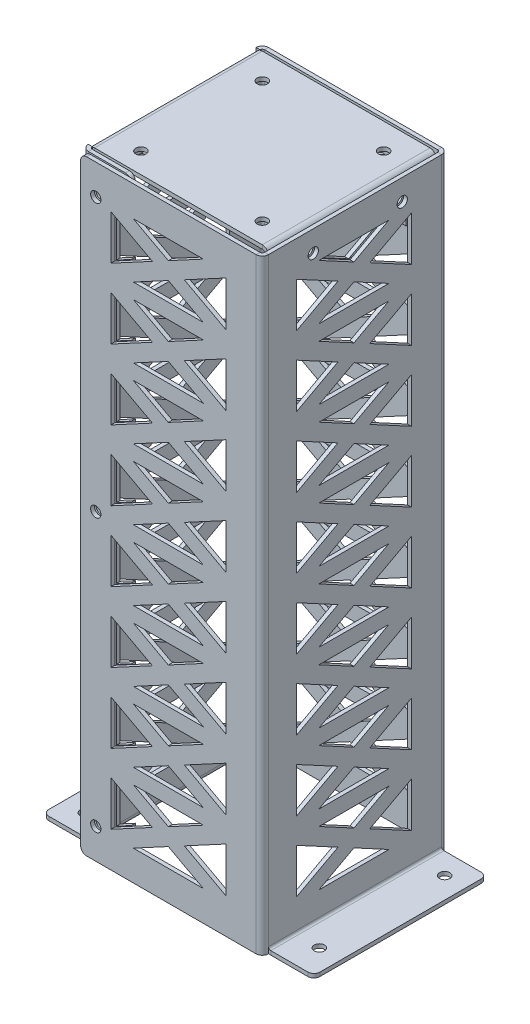
from build123d import *

# Parameters (mm, degrees)
SKETCH2_W                        = 60
SKETCH2_H                        = 200
BASE_FLANGE1_DEPTH               = 1.29
EDGE_FLANGE1_STRIP_W             = 6.684
EDGE_FLANGE1_STRIP_H             = 1.29
EDGE_FLANGE1_STRIP_CUT_DEPTH     = 200
EDGE_FLANGE1_DEPTH               = 200
EDGE_FLANGE2_STRIP_W             = 6.684
EDGE_FLANGE2_STRIP_H             = 1.29
EDGE_FLANGE2_STRIP_CUT_DEPTH     = 200
EDGE_FLANGE2_DEPTH               = 200
EDGE_FLANGE3_STRIP_W             = 6.684
EDGE_FLANGE3_STRIP_H             = 1.29
EDGE_FLANGE3_STRIP_CUT_DEPTH     = 200
EDGE_FLANGE3_DEPTH               = 200
EDGE_FLANGE4_STRIP_W             = 6.684
EDGE_FLANGE4_STRIP_H             = 1.29
EDGE_FLANGE4_STRIP_CUT_DEPTH     = 200
EDGE_FLANGE4_DEPTH               = 200
EDGE_FLANGE5_STRIP_W             = 6.684
EDGE_FLANGE5_STRIP_H             = 1.29
EDGE_FLANGE5_STRIP_CUT_DEPTH     = 57.186
EDGE_FLANGE5_DEPTH               = 57.186
EDGE_FLANGE6_STRIP_W             = 6.684
EDGE_FLANGE6_STRIP_H             = 1.29
EDGE_FLANGE6_STRIP_CUT_DEPTH     = 55.396
EDGE_FLANGE6_DEPTH               = 55.396
EDGE_FLANGE8_STRIP_W             = 6.684
EDGE_FLANGE8_STRIP_H             = 1.29
EDGE_FLANGE8_STRIP_CUT_DEPTH     = 55.396
EDGE_FLANGE8_DEPTH               = 55.396
EDGE_FLANGE9_START               = -59.238
EDGE_FLANGE9_DEPTH               = 55.396
EDGE_FLANGE9_2_DEPTH             = 55.396
SPEED_HOLE_DEPTH                 = 223.219405318
SPEED_HOLES_COUNT                = 8
SPEED_HOLES_PITCH                = 23.13
COPY_OF_SPEED_HOLES_COUNT        = 2
COPY_OF_SPEED_HOLES_ANGLE        = 90
COPY_OF_SPEED_HOLES_COPY_1_DEPTH = 223.219405318
COPY_OF_SPEED_HOLES_COPY_2_DEPTH = 223.219405318
COPY_OF_SPEED_HOLES_COPY_3_DEPTH = 223.219405318
COPY_OF_SPEED_HOLES_COPY_4_DEPTH = 223.219405318
COPY_OF_SPEED_HOLES_COPY_5_DEPTH = 223.219405318
COPY_OF_SPEED_HOLES_COPY_6_DEPTH = 223.219405318
COPY_OF_SPEED_HOLES_COPY_7_DEPTH = 223.219405318
M3_CLEARANCE_HOLE1_AT_2_COUNT    = 2
M3_CLEARANCE_HOLE1_AT_2_PITCH    = 41.396
M3_CLEARANCE_HOLE2_D             = 3.4
M3_START                         = -3.08
M3_CLEARANCE_HOLE3_OUTLINE_R     = 1.7
M3_CLEARANCE_HOLE3_DEPTH         = 3.08
M3_START_2                       = 56.92
M3_CLEARANCE_HOLE4_OUTLINE_R     = 1.7
M3_CLEARANCE_HOLE4_DEPTH         = 3.08
FILLET1_R                        = 2


# Read off the part's stored shape, not the designer's step: Edge-Flange9, M3 Clearance Hole3, M3 Clearance Hole4
# Sheet-metal steps are written as plain solids
with BuildPart() as part:
    # Sketch2 → Base-Flange1 (new body)
    with BuildSketch(Plane.XY):
        with Locations((30, 100)):
            Rectangle(SKETCH2_W, SKETCH2_H)
    extrude(amount=-BASE_FLANGE1_DEPTH)

    # Edge-Flange1 strip (across the edge) → Edge-Flange1 strip cut (cut)
    with BuildSketch(Plane(origin=(60, 200, -1.29), x_dir=(-1, 0, 0), z_dir=(0, -1, 0))):
        with Locations((-1.29, -0.645)):
            Rectangle(EDGE_FLANGE1_STRIP_W, EDGE_FLANGE1_STRIP_H)
    extrude(amount=EDGE_FLANGE1_STRIP_CUT_DEPTH, mode=Mode.SUBTRACT)

    # Edge-Flange1 section (across the edge) → Edge-Flange1 (add)
    with BuildSketch(Plane(origin=(60, 200, -1.29), x_dir=(-1, 0, 0), z_dir=(0, -1, 0))):
        with BuildLine():
            Line((0, 0.762), (0, 60))
            Line((0, 60), (1.29, 60))
            Line((1.29, 60), (1.29, 0.762))
            ThreePointArc((1.29, 0.762), (1.513184633, 0.223184633), (2.052, 0))
            Line((2.052, 0), (2.052, -1.29))
            ThreePointArc((2.052, -1.29), (0.601016885, -0.688983115), (0, 0.762))
        make_face()
    extrude(amount=EDGE_FLANGE1_DEPTH)

    # Edge-Flange2 strip (across the edge) → Edge-Flange2 strip cut (cut)
    with BuildSketch(Plane(origin=(58.71, 200, -61.29), x_dir=(0, 0, 1), z_dir=(0, -1, 0))):
        with Locations((-1.29, -0.645)):
            Rectangle(EDGE_FLANGE2_STRIP_W, EDGE_FLANGE2_STRIP_H)
    extrude(amount=EDGE_FLANGE2_STRIP_CUT_DEPTH, mode=Mode.SUBTRACT)

    # Edge-Flange2 section (across the edge) → Edge-Flange2 (add)
    with BuildSketch(Plane(origin=(58.71, 200, -61.29), x_dir=(0, 0, 1), z_dir=(0, -1, 0))):
        with BuildLine():
            Line((0, 0.762), (0, 60))
            Line((0, 60), (1.29, 60))
            Line((1.29, 60), (1.29, 0.762))
            ThreePointArc((1.29, 0.762), (1.513184633, 0.223184633), (2.052, 0))
            Line((2.052, 0), (2.052, -1.29))
            ThreePointArc((2.052, -1.29), (0.601016885, -0.688983115), (0, 0.762))
        make_face()
    extrude(amount=EDGE_FLANGE2_DEPTH)

    # Edge-Flange3 strip (across the edge) → Edge-Flange3 strip cut (cut)
    with BuildSketch(Plane(origin=(-1.29, 200, -60), x_dir=(1, 0, 0), z_dir=(0, -1, 0))):
        with Locations((-1.29, -0.645)):
            Rectangle(EDGE_FLANGE3_STRIP_W, EDGE_FLANGE3_STRIP_H)
    extrude(amount=EDGE_FLANGE3_STRIP_CUT_DEPTH, mode=Mode.SUBTRACT)

    # Edge-Flange3 section (across the edge) → Edge-Flange3 (add)
    with BuildSketch(Plane(origin=(-1.29, 200, -60), x_dir=(1, 0, 0), z_dir=(0, -1, 0))):
        with BuildLine():
            Line((0, 0.762), (0, 58.21))
            Line((0, 58.21), (1.29, 58.21))
            Line((1.29, 58.21), (1.29, 0.762))
            ThreePointArc((1.29, 0.762), (1.513184633, 0.223184633), (2.052, 0))
            Line((2.052, 0), (2.052, -1.29))
            ThreePointArc((2.052, -1.29), (0.601016885, -0.688983115), (0, 0.762))
        make_face()
    extrude(amount=EDGE_FLANGE3_DEPTH)

    # Edge-Flange4 strip (across the edge) → Edge-Flange4 strip cut (cut)
    with BuildSketch(Plane(origin=(0, 200, -1.79), x_dir=(0, 0, -1), z_dir=(0, -1, 0))):
        with Locations((-1.29, -0.645)):
            Rectangle(EDGE_FLANGE4_STRIP_W, EDGE_FLANGE4_STRIP_H)
    extrude(amount=EDGE_FLANGE4_STRIP_CUT_DEPTH, mode=Mode.SUBTRACT)

    # Edge-Flange4 section (across the edge) → Edge-Flange4 (add)
    with BuildSketch(Plane(origin=(0, 200, -1.79), x_dir=(0, 0, -1), z_dir=(0, -1, 0))):
        with BuildLine():
            Line((0, 0.762), (0, 15))
            Line((0, 15), (1.29, 15))
            Line((1.29, 15), (1.29, 0.762))
            ThreePointArc((1.29, 0.762), (1.513184633, 0.223184633), (2.052, 0))
            Line((2.052, 0), (2.052, -1.29))
            ThreePointArc((2.052, -1.29), (0.601016885, -0.688983115), (0, 0.762))
        make_face()
    extrude(amount=EDGE_FLANGE4_DEPTH)

    # Edge-Flange5 strip (across the edge) → Edge-Flange5 strip cut (cut)
    with BuildSketch(Plane(origin=(60, 0, -2.052), x_dir=(0, 1, 0), z_dir=(0, 0, -1))):
        with Locations((-1.29, -0.645)):
            Rectangle(EDGE_FLANGE5_STRIP_W, EDGE_FLANGE5_STRIP_H)
    extrude(amount=EDGE_FLANGE5_STRIP_CUT_DEPTH, mode=Mode.SUBTRACT)

    # Edge-Flange5 section (across the edge) → Edge-Flange5 (add)
    with BuildSketch(Plane(origin=(60, 0, -2.052), x_dir=(0, 1, 0), z_dir=(0, 0, -1))):
        with BuildLine():
            Line((0, 0.762), (0, 15))
            Line((0, 15), (1.29, 15))
            Line((1.29, 15), (1.29, 0.762))
            ThreePointArc((1.29, 0.762), (1.513184633, 0.223184633), (2.052, 0))
            Line((2.052, 0), (2.052, -1.29))
            ThreePointArc((2.052, -1.29), (0.601016885, -0.688983115), (0, 0.762))
        make_face()
    extrude(amount=EDGE_FLANGE5_DEPTH)

    # Edge-Flange6 strip (across the edge) → Edge-Flange6 strip cut (cut)
    with BuildSketch(Plane(origin=(-1.29, 0, -59.238), x_dir=(0, 1, 0), z_dir=(0, 0, 1))):
        with Locations((-1.29, -0.645)):
            Rectangle(EDGE_FLANGE6_STRIP_W, EDGE_FLANGE6_STRIP_H)
    extrude(amount=EDGE_FLANGE6_STRIP_CUT_DEPTH, mode=Mode.SUBTRACT)

    # Edge-Flange6 section (across the edge) → Edge-Flange6 (add)
    with BuildSketch(Plane(origin=(-1.29, 0, -59.238), x_dir=(0, 1, 0), z_dir=(0, 0, 1))):
        with BuildLine():
            Line((0, 0.762), (0, 15))
            Line((0, 15), (1.29, 15))
            Line((1.29, 15), (1.29, 0.762))
            ThreePointArc((1.29, 0.762), (1.513184633, 0.223184633), (2.052, 0))
            Line((2.052, 0), (2.052, -1.29))
            ThreePointArc((2.052, -1.29), (0.601016885, -0.688983115), (0, 0.762))
        make_face()
    extrude(amount=EDGE_FLANGE6_DEPTH)

    # Edge-Flange8 strip (across the edge) → Edge-Flange8 strip cut (cut)
    with BuildSketch(Plane(origin=(0, 200, -59.238), x_dir=(0, -1, 0), z_dir=(0, 0, 1))):
        with Locations((-1.29, -0.645)):
            Rectangle(EDGE_FLANGE8_STRIP_W, EDGE_FLANGE8_STRIP_H)
    extrude(amount=EDGE_FLANGE8_STRIP_CUT_DEPTH, mode=Mode.SUBTRACT)

    # Edge-Flange8 section (across the edge) → Edge-Flange8 (add)
    with BuildSketch(Plane(origin=(0, 200, -59.238), x_dir=(0, -1, 0), z_dir=(0, 0, 1))):
        with BuildLine():
            Line((0, 0.762), (0, 58.21))
            Line((0, 58.21), (1.29, 58.21))
            Line((1.29, 58.21), (1.29, 0.762))
            ThreePointArc((1.29, 0.762), (1.513184633, 0.223184633), (2.052, 0))
            Line((2.052, 0), (2.052, -1.29))
            ThreePointArc((2.052, -1.29), (0.601016885, -0.688983115), (0, 0.762))
        make_face()
    extrude(amount=EDGE_FLANGE8_DEPTH)

    # Edge-Flange9 outline → Edge-Flange9 (cut)
    with BuildSketch(Plane.XY.offset(EDGE_FLANGE9_START)):
        with BuildLine():
            ThreePointArc((56.158, 200), (57.308452085, 199.647165678), (58.063271634, 198.71))
            Line((58.063271634, 198.71), (58.21, 198.71))
            Line((58.21, 198.71), (58.21, 200))
            Line((58.21, 200), (56.158, 200))
        make_face()
    extrude(amount=EDGE_FLANGE9_DEPTH, mode=Mode.SUBTRACT)

    # Edge-Flange9 2 outline → Edge-Flange9 2 (add)
    with BuildSketch(Plane.XY.offset(EDGE_FLANGE9_START)):
        with BuildLine():
            Line((58.21, 183.71), (58.21, 197.948))
            ThreePointArc((58.21, 197.948), (58.172984044, 198.335999102), (58.063271634, 198.71))
            Line((58.063271634, 198.71), (56.158, 198.71))
            ThreePointArc((56.158, 198.71), (56.696815367, 198.486815367), (56.92, 197.948))
            Line((56.92, 197.948), (56.92, 183.71))
            Line((56.92, 183.71), (58.21, 183.71))
        make_face()
    extrude(amount=EDGE_FLANGE9_2_DEPTH)

    # Sketch37 → Speed Hole (cut, through all)
    with BuildSketch(Plane.XY):
        Polygon((28.974, 183.776865699), (17.416327699, 190), (40.531672301, 190), align=None)
        Polygon((23.700699328, 180.9375), (10, 188.31452971), (10, 173.56047029), align=None)
        Polygon((47.948, 173.56047029), (34.247300672, 180.9375), (47.948, 188.31452971), align=None)
        Polygon((28.974, 178.098134301), (17.416327699, 171.875), (40.531672301, 171.875), align=None)
    speed_hole = extrude(amount=-SPEED_HOLE_DEPTH, mode=Mode.SUBTRACT)

    # Speed Holes: Speed Hole ×8
    with Locations(*[(0, -i * SPEED_HOLES_PITCH, 0) for i in range(1, SPEED_HOLES_COUNT)]):
        add(speed_hole, mode=Mode.SUBTRACT)

    # Copy of Speed Holes: Speed Hole ×2 about axis
    copy_of_speed_holes_axis = Axis((29.355, -7.8454, -30.645), (0, 1, 0))
    for i in range(1, COPY_OF_SPEED_HOLES_COUNT):
        add(speed_hole.rotate(copy_of_speed_holes_axis, i * COPY_OF_SPEED_HOLES_ANGLE / (COPY_OF_SPEED_HOLES_COUNT - 1)), mode=Mode.SUBTRACT)

    # Copy of Speed Holes copy 1 sketch → Copy of Speed Holes copy 1 (cut, through all)
    with BuildSketch(Plane(origin=(60, -23.13, -1.29), x_dir=(0, 0, -1), z_dir=(1, 0, 0))):
        Polygon((28.974, 183.776865699), (17.416327699, 190), (40.531672301, 190), align=None)
        Polygon((23.700699328, 180.9375), (10, 188.31452971), (10, 173.56047029), align=None)
        Polygon((47.948, 173.56047029), (34.247300672, 180.9375), (47.948, 188.31452971), align=None)
        Polygon((28.974, 178.098134301), (17.416327699, 171.875), (40.531672301, 171.875), align=None)
    extrude(amount=-COPY_OF_SPEED_HOLES_COPY_1_DEPTH, mode=Mode.SUBTRACT)

    # Copy of Speed Holes copy 2 sketch → Copy of Speed Holes copy 2 (cut, through all)
    with BuildSketch(Plane(origin=(60, -46.26, -1.29), x_dir=(0, 0, -1), z_dir=(1, 0, 0))):
        Polygon((28.974, 183.776865699), (17.416327699, 190), (40.531672301, 190), align=None)
        Polygon((23.700699328, 180.9375), (10, 188.31452971), (10, 173.56047029), align=None)
        Polygon((47.948, 173.56047029), (34.247300672, 180.9375), (47.948, 188.31452971), align=None)
        Polygon((28.974, 178.098134301), (17.416327699, 171.875), (40.531672301, 171.875), align=None)
    extrude(amount=-COPY_OF_SPEED_HOLES_COPY_2_DEPTH, mode=Mode.SUBTRACT)

    # Copy of Speed Holes copy 3 sketch → Copy of Speed Holes copy 3 (cut, through all)
    with BuildSketch(Plane(origin=(60, -69.39, -1.29), x_dir=(0, 0, -1), z_dir=(1, 0, 0))):
        Polygon((28.974, 183.776865699), (17.416327699, 190), (40.531672301, 190), align=None)
        Polygon((23.700699328, 180.9375), (10, 188.31452971), (10, 173.56047029), align=None)
        Polygon((47.948, 173.56047029), (34.247300672, 180.9375), (47.948, 188.31452971), align=None)
        Polygon((28.974, 178.098134301), (17.416327699, 171.875), (40.531672301, 171.875), align=None)
    extrude(amount=-COPY_OF_SPEED_HOLES_COPY_3_DEPTH, mode=Mode.SUBTRACT)

    # Copy of Speed Holes copy 4 sketch → Copy of Speed Holes copy 4 (cut, through all)
    with BuildSketch(Plane(origin=(60, -92.52, -1.29), x_dir=(0, 0, -1), z_dir=(1, 0, 0))):
        Polygon((28.974, 183.776865699), (17.416327699, 190), (40.531672301, 190), align=None)
        Polygon((23.700699328, 180.9375), (10, 188.31452971), (10, 173.56047029), align=None)
        Polygon((47.948, 173.56047029), (34.247300672, 180.9375), (47.948, 188.31452971), align=None)
        Polygon((28.974, 178.098134301), (17.416327699, 171.875), (40.531672301, 171.875), align=None)
    extrude(amount=-COPY_OF_SPEED_HOLES_COPY_4_DEPTH, mode=Mode.SUBTRACT)

    # Copy of Speed Holes copy 5 sketch → Copy of Speed Holes copy 5 (cut, through all)
    with BuildSketch(Plane(origin=(60, -115.65, -1.29), x_dir=(0, 0, -1), z_dir=(1, 0, 0))):
        Polygon((28.974, 183.776865699), (17.416327699, 190), (40.531672301, 190), align=None)
        Polygon((23.700699328, 180.9375), (10, 188.31452971), (10, 173.56047029), align=None)
        Polygon((47.948, 173.56047029), (34.247300672, 180.9375), (47.948, 188.31452971), align=None)
        Polygon((28.974, 178.098134301), (17.416327699, 171.875), (40.531672301, 171.875), align=None)
    extrude(amount=-COPY_OF_SPEED_HOLES_COPY_5_DEPTH, mode=Mode.SUBTRACT)

    # Copy of Speed Holes copy 6 sketch → Copy of Speed Holes copy 6 (cut, through all)
    with BuildSketch(Plane(origin=(60, -138.78, -1.29), x_dir=(0, 0, -1), z_dir=(1, 0, 0))):
        Polygon((28.974, 183.776865699), (17.416327699, 190), (40.531672301, 190), align=None)
        Polygon((23.700699328, 180.9375), (10, 188.31452971), (10, 173.56047029), align=None)
        Polygon((47.948, 173.56047029), (34.247300672, 180.9375), (47.948, 188.31452971), align=None)
        Polygon((28.974, 178.098134301), (17.416327699, 171.875), (40.531672301, 171.875), align=None)
    extrude(amount=-COPY_OF_SPEED_HOLES_COPY_6_DEPTH, mode=Mode.SUBTRACT)

    # Copy of Speed Holes copy 7 sketch → Copy of Speed Holes copy 7 (cut, through all)
    with BuildSketch(Plane(origin=(60, -161.91, -1.29), x_dir=(0, 0, -1), z_dir=(1, 0, 0))):
        Polygon((28.974, 183.776865699), (17.416327699, 190), (40.531672301, 190), align=None)
        Polygon((23.700699328, 180.9375), (10, 188.31452971), (10, 173.56047029), align=None)
        Polygon((47.948, 173.56047029), (34.247300672, 180.9375), (47.948, 188.31452971), align=None)
        Polygon((28.974, 178.098134301), (17.416327699, 171.875), (40.531672301, 171.875), align=None)
    extrude(amount=-COPY_OF_SPEED_HOLES_COPY_7_DEPTH, mode=Mode.SUBTRACT)

    # Sketch39 → M3 Clearance Hole1 (revolve, cut)
    with BuildSketch(Plane(origin=(-9.29, 1.29, -52.238), x_dir=(0, 0, 1), z_dir=(1, 0, 0))):
        Polygon((0, 0), (0, 13.021463052), (1.7, 12), (1.7, 0), align=None)
    m3_clearance_hole1 = revolve(axis=Axis((-9.29, 7.64, -52.238), (0, -1, 0)), mode=Mode.SUBTRACT)

    # M3 Clearance Hole1 at 2: M3 Clearance Hole1 ×2
    with Locations(*[(0, 0, i * M3_CLEARANCE_HOLE1_AT_2_PITCH) for i in range(1, M3_CLEARANCE_HOLE1_AT_2_COUNT)]):
        add(m3_clearance_hole1, mode=Mode.SUBTRACT)

    # Copy of M3 Hole1: M3 Clearance Hole1 across plane
    add(m3_clearance_hole1.mirror(Plane.ZY.offset(-29.355)), mode=Mode.SUBTRACT)

    # Copy of M3 Hole1 copy 1 sketch → Copy of M3 Hole1 copy 1 (revolve, cut)
    with BuildSketch(Plane(origin=(68, 1.29, -10.842), x_dir=(0, 0, 1), z_dir=(-1, 0, 0))):
        Polygon((0, 0), (0, -13.021463052), (1.7, -12), (1.7, 0), align=None)
    revolve(axis=Axis((68, 7.64, -10.842), (0, 1, 0)), mode=Mode.SUBTRACT)

    # M3 Clearance Hole2 (through all)
    with Locations(Plane(origin=(0, 200, 0), x_dir=(1, 0, 0), z_dir=(0, 1, 0))):
        with Locations((9.311016885, 50.688983115), (49.398983115, 50.688983115), (49.398983115, 10.601016885), (9.311016885, 10.601016885)):
            Hole(M3_CLEARANCE_HOLE2_D / 2)

    # M3 Clearance Hole3 outline → M3 Clearance Hole3 (cut)
    with BuildSketch(Plane.XY.offset(M3_START)):
        with Locations((5, 100)):
            Circle(M3_CLEARANCE_HOLE3_OUTLINE_R)
        with Locations((5, 10)):
            Circle(M3_CLEARANCE_HOLE3_OUTLINE_R)
        with Locations((5, 190)):
            Circle(M3_CLEARANCE_HOLE3_OUTLINE_R)
    extrude(amount=M3_CLEARANCE_HOLE3_DEPTH, mode=Mode.SUBTRACT)

    # M3 Clearance Hole4 outline → M3 Clearance Hole4 (cut)
    with BuildSketch(Plane.YZ.offset(M3_START_2)):
        with Locations((193, -46.238)):
            Circle(M3_CLEARANCE_HOLE4_OUTLINE_R)
        with Locations((193, -16.842)):
            Circle(M3_CLEARANCE_HOLE4_OUTLINE_R)
    extrude(amount=M3_CLEARANCE_HOLE4_DEPTH, mode=Mode.SUBTRACT)

    # Fillet1
    fillet1_edges = [part.edges().sort_by_distance(p)[0] for p in [
        (15, 200, -2.435),
        (15, 0, -2.435),
        (75, 0.645, -2.052),
        (75, 0.645, -59.238),
        (-16.29, 0.645, -59.238),
        (-16.29, 0.645, -3.842),
        (57.565, 183.71, -59.238),
        (57.565, 183.71, -3.842),
        (0, 200, -0.645),
        (0, 0, -0.645),
    ]]
    fillet(fillet1_edges, radius=FILLET1_R)


solid = part.part
